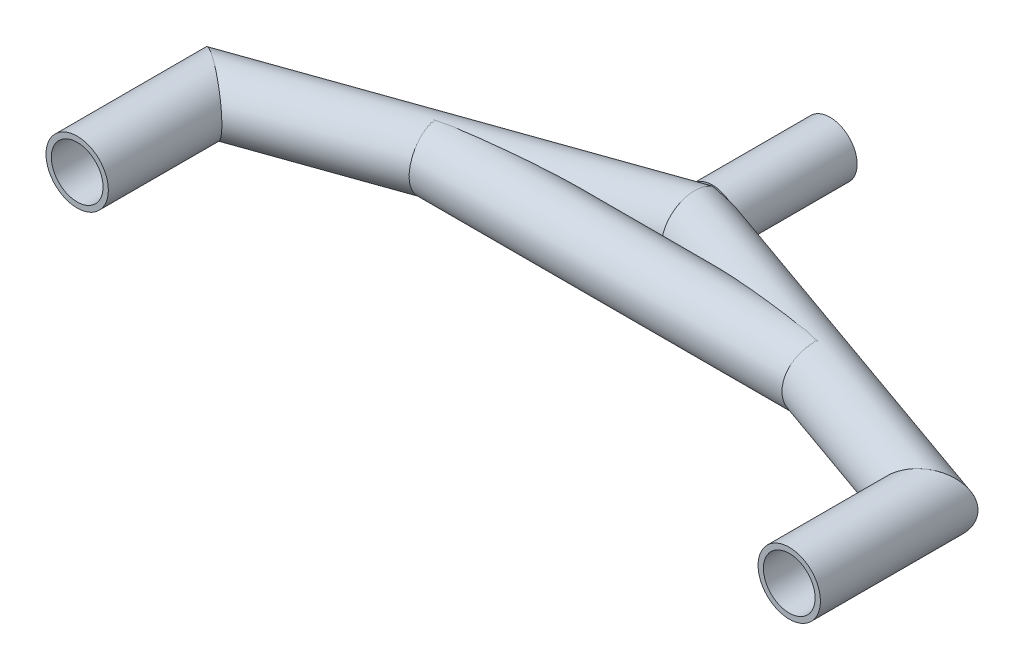
from build123d import *

# Parameters (mm, degrees)
SKETCH1_R                                      = 6.9
SKETCH1_R_2                                    = 5.725
C_PROGRAM_FILES_SOLIDWORKS_CORP_SOLIDWOR_DEPTH = 91.484727216
SKETCH1_ON_SEGMENT_2_R                         = 6.9
SKETCH1_ON_SEGMENT_2_R_2                       = 5.725
C_PROGRAM_FILES_SOLIDWORKS_CORP_SOLI_3_DEPTH   = 37.901943701
SKETCH11_R                                     = 6.9
SKETCH11_R_2                                   = 5.725
CIRCULAR_TUBE_26_9_X_2_3_2_DEPTH               = 91.484727216
SKETCH11_ON_SEGMENT_2_R                        = 6.9
SKETCH11_ON_SEGMENT_2_R_2                      = 5.725
CIRCULAR_TUBE_26_9_X_2_3_2_2_DEPTH             = 37.901943701
SKETCH12_R                                     = 6.9
SKETCH12_R_2                                   = 5.725
CIRCULAR_TUBE_26_9_X_2_3_3_DEPTH               = 84.924568966
WELD_TRIM_1_OUTLINE_W                          = 5.725
WELD_TRIM_1_OUTLINE_H                          = 38.951410817
WELD_TRIM_2_OUTLINE_W                          = 5.725
WELD_TRIM_2_OUTLINE_H                          = 38.951445723
PART_START                                     = 2e-09
PART_RUN_ON_DEPTH                              = 73.1683
BODY_START                                     = -3e-09
BODY_3_RUN_ON_DEPTH                            = 58.289875
SKETCH_10_R                                    = 6
EXTRUDE_3_DEPTH                                = 26


# Read off the part's stored shape, not the designer's step: 잘라내기/늘리기1, 잘라내기/늘리기2
with BuildPart() as part:
    # Sketch1 → C_PROGRAM FILES_SOLIDWORKS CORP_SOLIDWOR (new body)
    with BuildSketch(Plane(origin=(0, 0, -27.84), x_dir=(0.3330829487777661, 0, 0.9428975284905078), z_dir=(-0.9428975284905078, 0, 0.33308294877776606))):
        Circle(SKETCH1_R)
        Circle(SKETCH1_R_2, mode=Mode.SUBTRACT)
    extrude(amount=C_PROGRAM_FILES_SOLIDWORKS_CORP_SOLIDWOR_DEPTH)

    # C_PROGRAM FILES_SOLIDWORKS CORP_SOLI 2
    split(bisect_by=Plane(origin=(-78.81, 0, 0), x_dir=(0, 1, 0), z_dir=(0.577458679, 0, -0.816419913)), keep=Keep.TOP)

    # Sketch1 → part run on (add)
    with BuildSketch(Plane(origin=(0, 0, -27.84), x_dir=(0.3330829487777661, 0, 0.9428975284905078), z_dir=(-0.9428975284905078, 0, 0.33308294877776606)).offset(PART_START)):
        Circle(SKETCH1_R)
        Circle(SKETCH1_R_2, mode=Mode.SUBTRACT)
    extrude(amount=-PART_RUN_ON_DEPTH)

    # Weld Trim 3
    split(bisect_by=Plane(origin=(0, 0, -27.84), x_dir=(0, -1, 0), z_dir=(-1, 0, 0)), keep=Keep.TOP)



with BuildPart() as body_2:
    # Sketch1 on segment 2 (carried to segment 2) → C_PROGRAM FILES_SOLIDWORKS CORP_SOLI 3 (new body)
    with BuildSketch(Plane(origin=(-78.81, 0, -7.901943701), x_dir=(1, 0, 0), z_dir=(0, 0, 1))):
        Circle(SKETCH1_ON_SEGMENT_2_R)
        Circle(SKETCH1_ON_SEGMENT_2_R_2, mode=Mode.SUBTRACT)
    extrude(amount=C_PROGRAM_FILES_SOLIDWORKS_CORP_SOLI_3_DEPTH)

    # C_PROGRAM FILES_SOLIDWORKS CORP_SOLI 3 m
    split(bisect_by=Plane(origin=(-78.81, 0, 0), x_dir=(0, -1, 0), z_dir=(-0.577458679, 0, 0.816419913)), keep=Keep.TOP)


with BuildPart() as body_3:
    # Sketch11 → Circular tube 26.9 X 2.3(2) (new body)
    with BuildSketch(Plane(origin=(0, 0, -27.84), x_dir=(0.33308294877776584, 0, -0.9428975284905079), z_dir=(0.9428975284905079, 0, 0.33308294877776584))):
        Circle(SKETCH11_R)
        Circle(SKETCH11_R_2, mode=Mode.SUBTRACT)
    extrude(amount=CIRCULAR_TUBE_26_9_X_2_3_2_DEPTH)

    # Circular tube 26.9 X 2.3(2) mitre 1
    split(bisect_by=Plane(origin=(78.81, 0, 0), x_dir=(0, -1, 0), z_dir=(-0.577458679, 0, -0.816419913)), keep=Keep.TOP)

    # Sketch11 → body 3 run on (add)
    with BuildSketch(Plane(origin=(0, 0, -27.84), x_dir=(0.33308294877776584, 0, -0.9428975284905079), z_dir=(0.9428975284905079, 0, 0.33308294877776584)).offset(BODY_START)):
        Circle(SKETCH11_R)
        Circle(SKETCH11_R_2, mode=Mode.SUBTRACT)
    extrude(amount=-BODY_3_RUN_ON_DEPTH)

    # Weld Trim 3
    split(bisect_by=Plane(origin=(0, 0, -27.84), x_dir=(0, 1, 0), z_dir=(1, 0, 0)), keep=Keep.TOP)


with BuildPart() as body_4:
    # Sketch11 on segment 2 (carried to segment 2) → Circular tube 26.9 X 2.3_2 2 (new body)
    with BuildSketch(Plane(origin=(78.81, 0, -7.901943701), x_dir=(1, 0, 0), z_dir=(0, 0, 1))):
        Circle(SKETCH11_ON_SEGMENT_2_R)
        Circle(SKETCH11_ON_SEGMENT_2_R_2, mode=Mode.SUBTRACT)
    extrude(amount=CIRCULAR_TUBE_26_9_X_2_3_2_2_DEPTH)

    # Circular tube 26.9 X 2.3_2 2 mitre 1
    split(bisect_by=Plane(origin=(78.81, 0, 0), x_dir=(0, 1, 0), z_dir=(0.577458679, 0, 0.816419913)), keep=Keep.TOP)


with BuildPart() as body_5:
    # Sketch12 → Circular tube 26.9 X 2.3(3) (new body)
    with BuildSketch(Plane(origin=(-42.462284483, 0, -12.84), x_dir=(0, 0, -1), z_dir=(1, 0, 0))):
        Circle(SKETCH12_R)
        Circle(SKETCH12_R_2, mode=Mode.SUBTRACT)
    extrude(amount=CIRCULAR_TUBE_26_9_X_2_3_3_DEPTH)

    # Weld Trim 1 outline → Weld Trim 1 (revolve, cut)
    with BuildSketch(Plane(origin=(8.743516403, 0, -24.751312059), x_dir=(0, 1, 0), z_dir=(0.333082948777766, 0, -0.942897528490508))):
        with Locations((2.8625, 18.314360576)):
            Rectangle(WELD_TRIM_1_OUTLINE_W, WELD_TRIM_1_OUTLINE_H)
    revolve(axis=Axis((8.743516403, 0, -24.751312059), (0.942897528490508, 0, 0.333082948777766)), mode=Mode.SUBTRACT)

    # Weld Trim 2 outline → Weld Trim 2 (revolve, cut)
    with BuildSketch(Plane(origin=(-8.743516403, 0, -24.751312059), x_dir=(0, 1, 0), z_dir=(-0.333082948777766, 0, -0.942897528490508))):
        with Locations((2.8625, -18.314343123)):
            Rectangle(WELD_TRIM_2_OUTLINE_W, WELD_TRIM_2_OUTLINE_H)
    revolve(axis=Axis((-8.743516403, 0, -24.751312059), (0.942897528490508, 0, -0.333082948777766)), mode=Mode.SUBTRACT)


with BuildPart() as part_1:
    add(part.part)

    add(body_3.part)  # 보스-돌출3 merges body 3
    # 스케치10 → 보스-돌출3 (add)
    with BuildSketch(Plane.XY.offset(-57.84)):
        with Locations(Location((0, 0, 0), (0, 0, 127.290512292))):
            Circle(SKETCH_10_R)
    extrude(amount=EXTRUDE_3_DEPTH)


solid = Compound([body_2.part, body_4.part, body_5.part, part_1.part])
